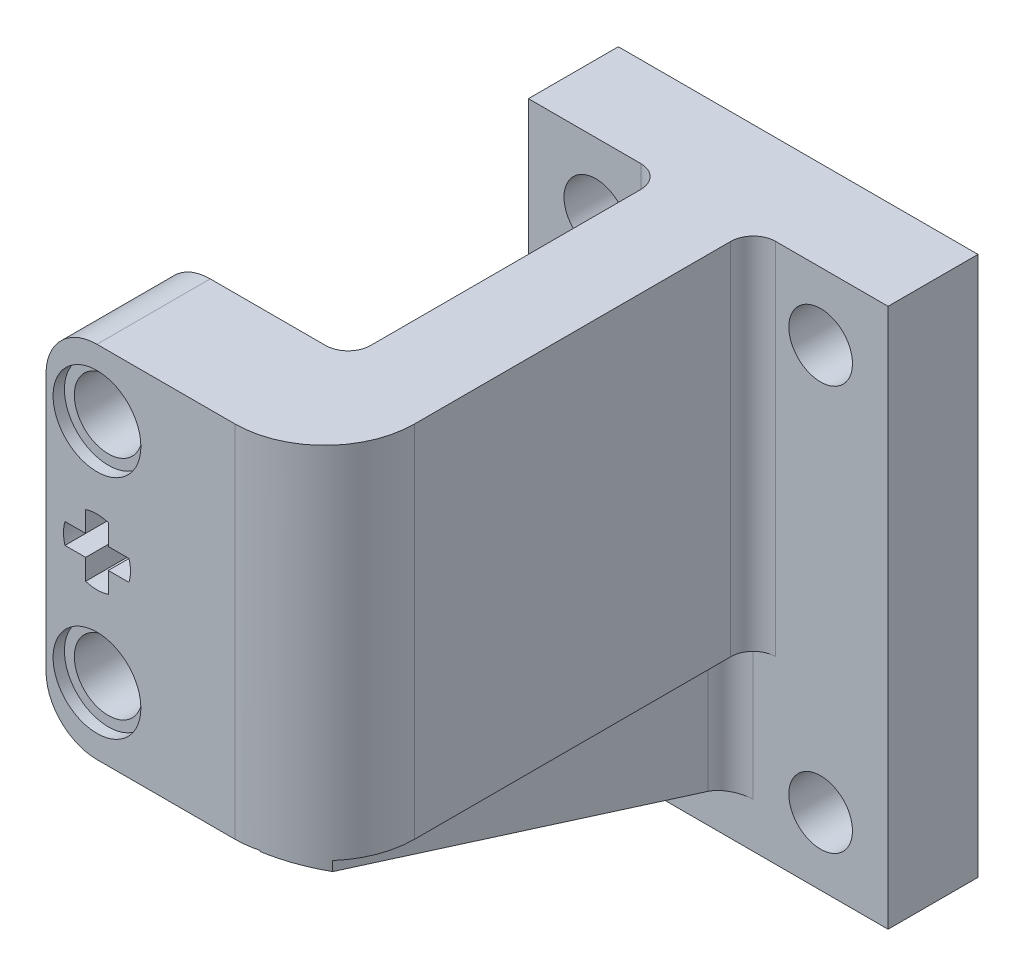
from build123d import *

# Parameters (mm, degrees)
BOSS_EXTRUDE1_DEPTH       = 12.7
SKETCH2_R                 = 2.4
CUT_EXTRUDE1_DEPTH        = 25.4
SKETCH2_3_R               = 3.1
CUT_EXTRUDE2_DEPTH        = 0.8
FILLET1_R                 = 3.6
SKETCH7_W                 = 25.4
SKETCH7_H                 = 38.1
BOSS_EXTRUDE2_DEPTH       = 6.35
F_8_CLEARANCE_HOLE1_D     = 4.4958
F_8_CLEARANCE_HOLE1_DEPTH = 6.35
BOSS_EXTRUDE3_DEPTH       = 1.5875
FILLET2_R                 = 6.35
FILLET3_R                 = 1.5875
FILLET4_R                 = 1.5875


# Some blends are built 0.0001 mm under size
with BuildPart() as part:
    # Sketch1 → Boss-Extrude1 (new, symmetric)
    with BuildSketch(Plane(origin=(0, 0, 0), x_dir=(1, 0, 0), z_dir=(0, 1, 0))):
        Polygon((0, 0), (0, -22.256250002), (-13.335, -22.256250002), (-13.335, -30.256250002), (6.35, -30.256250002), (6.35, 0), (15.875, 0), (15.875, 6.35), (-9.525, 6.35), (-9.525, 0), align=None)
    extrude(amount=BOSS_EXTRUDE1_DEPTH, both=True)

    # Sketch2 → Cut-Extrude1 (cut)
    with BuildSketch(Plane.XY.offset(30.256250002)):
        with BuildLine():
            ThreePointArc((-7.4722583, 0.73137085), (-7.367272665, 0), (-7.4722583, -0.73137085))
            Line((-7.4722583, -0.73137085), (-8.935, -0.73137085))
            Line((-8.935, -0.73137085), (-8.935, -2.19411255))
            ThreePointArc((-8.935, -2.19411255), (-9.735, -2.320249175), (-10.535, -2.19411255))
            Line((-10.535, -2.19411255), (-10.535, -0.73137085))
            Line((-10.535, -0.73137085), (-11.9977417, -0.73137085))
            ThreePointArc((-11.9977417, -0.73137085), (-12.102727335, 0), (-11.9977417, 0.73137085))
            Line((-11.9977417, 0.73137085), (-10.535, 0.73137085))
            Line((-10.535, 0.73137085), (-10.535, 2.19411255))
            ThreePointArc((-10.535, 2.19411255), (-9.735, 2.320249175), (-8.935, 2.19411255))
            Line((-8.935, 2.19411255), (-8.935, 0.73137085))
            Line((-8.935, 0.73137085), (-7.4722583, 0.73137085))
        make_face()
        with Locations((-9.735, -8)):
            Circle(SKETCH2_R)
        with Locations((-9.735, 8)):
            Circle(SKETCH2_R)
    extrude(amount=-CUT_EXTRUDE1_DEPTH, mode=Mode.SUBTRACT)

    # Sketch2<3> → Cut-Extrude2 (cut)
    with BuildSketch(Plane.XY.offset(30.256250002)):
        with Locations((-9.735, 8)):
            Circle(SKETCH2_3_R)
        with Locations((-9.735, -8)):
            Circle(SKETCH2_3_R)
    cut_extrude2 = extrude(amount=-CUT_EXTRUDE2_DEPTH, mode=Mode.SUBTRACT)

    # Mirror1: Cut-Extrude2 across plane
    add(cut_extrude2.mirror(Plane.XY.offset(26.256250002)), mode=Mode.SUBTRACT)

    # Fillet1
    fillet1_edges = [part.edges().sort_by_distance(p)[0] for p in [
        (-13.335, -12.7, 26.256250002),
        (-13.335, 12.7, 26.256250002),
    ]]
    fillet(fillet1_edges, radius=FILLET1_R)

    # Sketch7 → Boss-Extrude2 (add)
    with BuildSketch(Plane(origin=(0, 0, -6.35), x_dir=(-1, 0, 0), z_dir=(0, 0, -1))):
        with Locations((-3.175, -6.35)):
            Rectangle(SKETCH7_W, SKETCH7_H)
    extrude(amount=-BOSS_EXTRUDE2_DEPTH)

    # #8 Clearance Hole1
    with Locations(Plane(origin=(0, 0, -6.35), x_dir=(-1, 0, 0), z_dir=(0, 0, -1))):
        with Locations((-11.1125, 7.9375), (4.7625, 7.9375), (4.7625, -20.6375), (-11.1125, -20.6375)):
            Hole(F_8_CLEARANCE_HOLE1_D / 2, depth=F_8_CLEARANCE_HOLE1_DEPTH)

    # Sketch8 → Boss-Extrude3 (add, symmetric)
    with BuildSketch(Plane(origin=(3.175, 0, 0), x_dir=(0, 0, -1), z_dir=(1, 0, 0))):
        Polygon((0, -22.225), (-30.256250002, -12.7), (0, -12.7), align=None)
    extrude(amount=BOSS_EXTRUDE3_DEPTH, both=True)

    # Fillet2
    # the kernel refuses this fillet: 6.35 mm, written as the material it takes off along each edge
    with BuildSketch(Plane(origin=(6.35, -28.575, 30.256250002), x_dir=(-1, 0, 0), z_dir=(0, 1, 0))) as fillet2_piece_1:
        with BuildLine():
            CenterArc((FILLET2_R, -FILLET2_R), FILLET2_R, 90, 90)
            Line((0, -FILLET2_R), (0, 0))
            Line((0, 0), (FILLET2_R, 0))
        make_face()
    extrude(amount=57.15, mode=Mode.SUBTRACT)

    # Fillet3
    fillet3_edges = [part.edges().sort_by_distance(p)[0] for p in [
        (0, 0, 22.256250002),
    ]]
    fillet(fillet3_edges, radius=FILLET3_R)

    # Fillet4
    fillet4_edges = [part.edges().sort_by_distance(p)[0] for p in [
        (0, 0, 0),
        (6.35, 0, 0),
        (1.5875, -17.4625, 0),
        (4.7625, -17.4625, 0),
    ]]
    fillet(fillet4_edges, radius=FILLET4_R - 0.0001)  # a hair under: the kernel refuses the full size


solid = part.part
